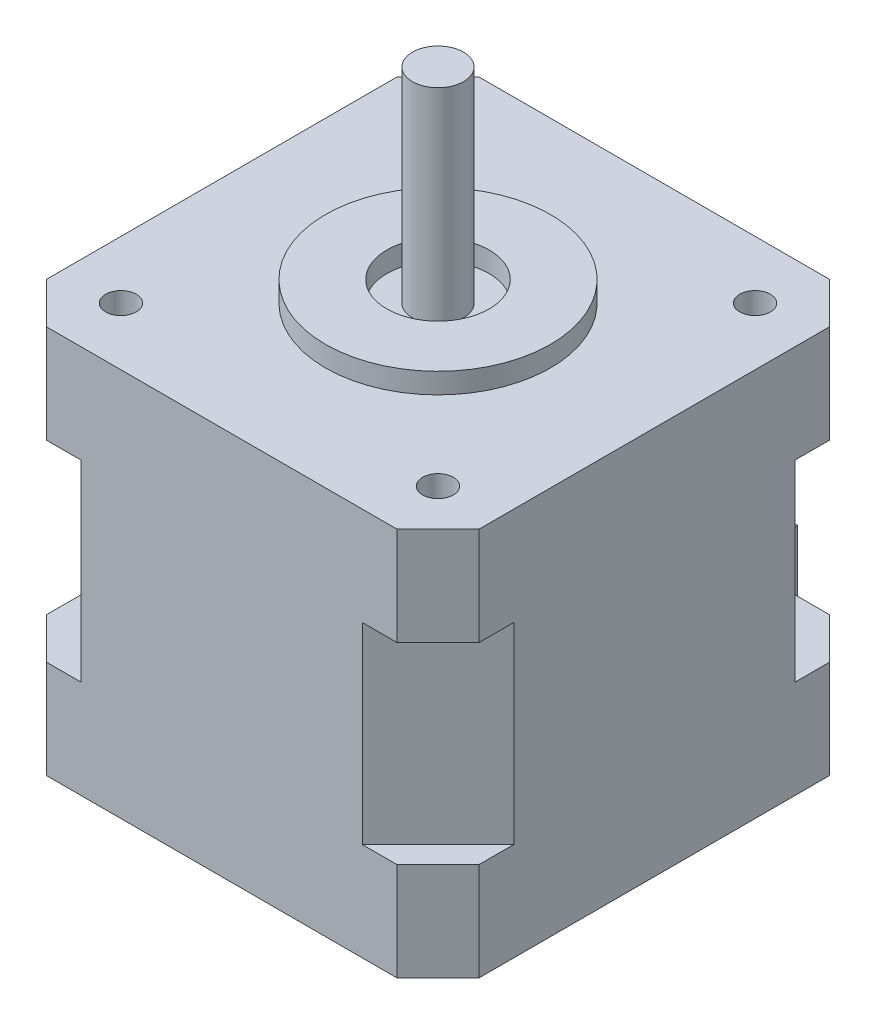
from build123d import *

# Parameters (mm, degrees)
SKETCH1_W               = 42.3
SKETCH1_H               = 42.3
BOSS_EXTRUDE1_DEPTH     = 9.6
CHAMFER1_SIZE           = 4
BOSS_EXTRUDE2_DEPTH     = 18.8
BOSS_EXTRUDE3_DEPTH     = 9.6
SKETCH4_R               = 11
SKETCH4_R_2             = 5
BOSS_EXTRUDE4_DEPTH     = 2
SKETCH5_R               = 2.5
BOSS_EXTRUDE5_DEPTH     = 20
SKETCH8_R               = 1.5
CUT_EXTRUDE1_DEPTH      = 4
MIRROR2_COPY_1_SKETCH_R = 1.5
MIRROR2_COPY_1_DEPTH    = 4
MIRROR3_COPY_1_SKETCH_R = 1.5
MIRROR3_COPY_1_DEPTH    = 4
MIRROR3_COPY_2_SKETCH_R = 1.5
MIRROR3_COPY_2_DEPTH    = 4
MIRROR3_COPY_3_SKETCH_R = 1.5
MIRROR3_COPY_3_DEPTH    = 4
SKETCH9_W               = 16
SKETCH9_H               = 9.6
BOSS_EXTRUDE6_DEPTH     = 4
SKETCH10_W              = 16
SKETCH10_H              = 6.4
BOSS_EXTRUDE7_DEPTH     = 2
SKETCH11_W              = 15
SKETCH11_H              = 5.4
CUT_EXTRUDE2_DEPTH      = 4


with BuildPart() as part:
    # Sketch1 → Boss-Extrude1 (new body)
    with BuildSketch(Plane(origin=(0, 0, 0), x_dir=(1, 0, 0), z_dir=(0, 1, 0))):
        Rectangle(SKETCH1_W, SKETCH1_H)
    extrude(amount=BOSS_EXTRUDE1_DEPTH)

    # Chamfer1
    chamfer1_edges = [part.edges().sort_by_distance(p)[0] for p in [
        (21.15, 4.8, -21.15),
        (21.15, 4.8, 21.15),
        (-21.15, 4.8, 21.15),
        (-21.15, 4.8, -21.15),
    ]]
    chamfer(chamfer1_edges, length=CHAMFER1_SIZE)

    # Sketch2 → Boss-Extrude2 (add)
    with BuildSketch(Plane(origin=(0, 9.6, 0), x_dir=(1, 0, 0), z_dir=(0, 1, 0))):
        Polygon((13.75, -21.15), (21.15, -13.74318557), (21.15, 13.74318557), (13.75, 21.15), (-13.75, 21.15), (-21.15, 13.74318557), (-21.15, -13.74318557), (-13.75, -21.15), align=None)
    extrude(amount=BOSS_EXTRUDE2_DEPTH)

    # Sketch3 → Boss-Extrude3 (add)
    with BuildSketch(Plane(origin=(0, 28.4, 0), x_dir=(1, 0, 0), z_dir=(0, 1, 0))):
        Polygon((17.15, 21.15), (-17.15, 21.15), (-21.15, 17.15), (-21.15, -17.15), (-17.15, -21.15), (17.15, -21.15), (21.15, -17.15), (21.15, 17.15), align=None)
    extrude(amount=BOSS_EXTRUDE3_DEPTH)

    # Sketch4 → Boss-Extrude4 (add)
    with BuildSketch(Plane(origin=(0, 38, 0), x_dir=(1, 0, 0), z_dir=(0, 1, 0))):
        Circle(SKETCH4_R)
        Circle(SKETCH4_R_2, mode=Mode.SUBTRACT)
    extrude(amount=BOSS_EXTRUDE4_DEPTH)

    # Sketch5 → Boss-Extrude5 (add)
    with BuildSketch(Plane(origin=(0, 38, 0), x_dir=(1, 0, 0), z_dir=(0, 1, 0))):
        Circle(SKETCH5_R)
    extrude(amount=BOSS_EXTRUDE5_DEPTH)

    # Sketch8 → Cut-Extrude1 (cut)
    with BuildSketch(Plane(origin=(0, 38, 0), x_dir=(1, 0, 0), z_dir=(0, 1, 0))):
        with Locations((15.5, -15.5)):
            Circle(SKETCH8_R)
    cut_extrude1 = extrude(amount=-CUT_EXTRUDE1_DEPTH, mode=Mode.SUBTRACT)

    # Mirror1: Cut-Extrude1 across plane
    add(cut_extrude1.mirror(Plane.XY), mode=Mode.SUBTRACT)

    # Mirror2: Cut-Extrude1 across plane
    add(cut_extrude1.mirror(Plane(origin=(0, 0, 0), x_dir=(0, 0, 1), z_dir=(1, 0, 0))), mode=Mode.SUBTRACT)

    # Mirror2 copy 1 sketch → Mirror2 copy 1 (cut)
    with BuildSketch(Plane(origin=(0, 38, 0), x_dir=(-1, 0, 0), z_dir=(0, 1, 0))):
        with Locations((15.5, -15.5)):
            Circle(MIRROR2_COPY_1_SKETCH_R)
    extrude(amount=-MIRROR2_COPY_1_DEPTH, mode=Mode.SUBTRACT)

    # Mirror3: Cut-Extrude1 across plane
    add(cut_extrude1.mirror(Plane.ZX.offset(19)), mode=Mode.SUBTRACT)

    # Mirror3 copy 1 sketch → Mirror3 copy 1 (cut)
    with BuildSketch(Plane.XZ):
        with Locations((15.5, -15.5)):
            Circle(MIRROR3_COPY_1_SKETCH_R)
    extrude(amount=-MIRROR3_COPY_1_DEPTH, mode=Mode.SUBTRACT)

    # Mirror3 copy 2 sketch → Mirror3 copy 2 (cut)
    with BuildSketch(Plane(origin=(0, 0, 0), x_dir=(-1, 0, 0), z_dir=(0, -1, 0))):
        with Locations((15.5, -15.5)):
            Circle(MIRROR3_COPY_2_SKETCH_R)
    extrude(amount=-MIRROR3_COPY_2_DEPTH, mode=Mode.SUBTRACT)

    # Mirror3 copy 3 sketch → Mirror3 copy 3 (cut)
    with BuildSketch(Plane(origin=(0, 0, 0), x_dir=(-1, 0, 0), z_dir=(0, -1, 0))):
        with Locations((15.5, 15.5)):
            Circle(MIRROR3_COPY_3_SKETCH_R)
    extrude(amount=-MIRROR3_COPY_3_DEPTH, mode=Mode.SUBTRACT)

    # Sketch9 → Boss-Extrude6 (add)
    with BuildSketch(Plane(origin=(0, 0, -21.15), x_dir=(-1, 0, 0), z_dir=(0, 0, -1))):
        with Locations((0, 4.8)):
            Rectangle(SKETCH9_W, SKETCH9_H)
    extrude(amount=BOSS_EXTRUDE6_DEPTH)

    # Sketch10 → Boss-Extrude7 (add)
    with BuildSketch(Plane(origin=(0, 0, -25.15), x_dir=(-1, 0, 0), z_dir=(0, 0, -1))):
        with Locations((0, 6.4)):
            Rectangle(SKETCH10_W, SKETCH10_H)
    extrude(amount=BOSS_EXTRUDE7_DEPTH)

    # Sketch11 → Cut-Extrude2 (cut)
    with BuildSketch(Plane(origin=(0, 0, -27.15), x_dir=(-1, 0, 0), z_dir=(0, 0, -1))):
        with Locations((0, 6.4)):
            Rectangle(SKETCH11_W, SKETCH11_H)
    extrude(amount=-CUT_EXTRUDE2_DEPTH, mode=Mode.SUBTRACT)


solid = part.part
